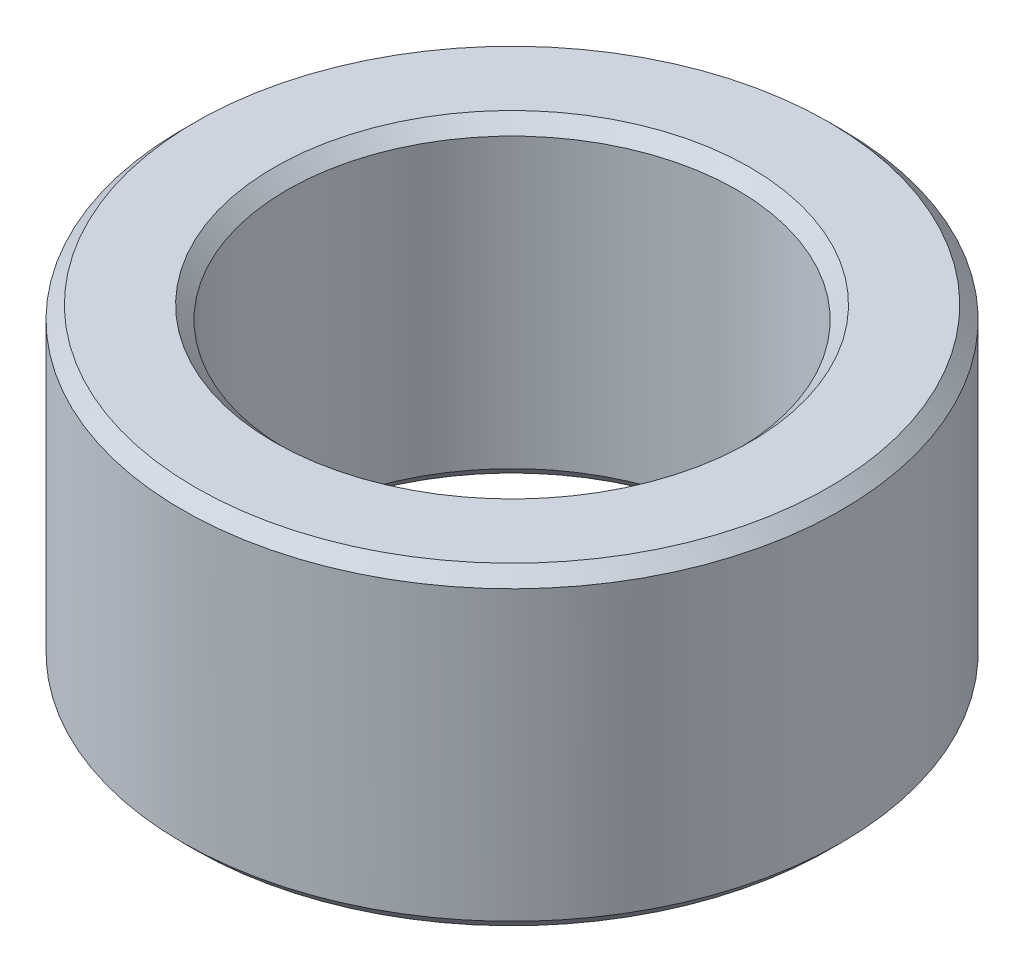
from build123d import *

# Parameters (mm, degrees)
SKETCH1_R           = 35
BOSS_EXTRUDE1_DEPTH = 33.342532713
SKETCH2_R           = 23.887633558
CUT_EXTRUDE1_DEPTH  = 60.680185051
CHAMFER1_SIZE       = 1.379488218


with BuildPart() as part:
    # Sketch1 → Boss-Extrude1 (new body)
    with BuildSketch(Plane(origin=(0, 0, 0), x_dir=(1, 0, 0), z_dir=(0, 1, 0))):
        Circle(SKETCH1_R)
    extrude(amount=BOSS_EXTRUDE1_DEPTH)

    # Sketch2 → Cut-Extrude1 (cut, through all)
    with BuildSketch(Plane(origin=(0, 0, 0), x_dir=(1, 0, 0), z_dir=(0, 1, 0))):
        Circle(SKETCH2_R)
    extrude(amount=CUT_EXTRUDE1_DEPTH, mode=Mode.SUBTRACT)

    # Chamfer1
    chamfer1_edges = [part.edges().sort_by_distance(p)[0] for p in [
        (-23.887633558, 33.342532713, 0),
        (-23.887633558, 0, 0),
        (-35, 0, 0),
        (-35, 33.342532713, 0),
    ]]
    chamfer(chamfer1_edges, length=CHAMFER1_SIZE)


solid = part.part
